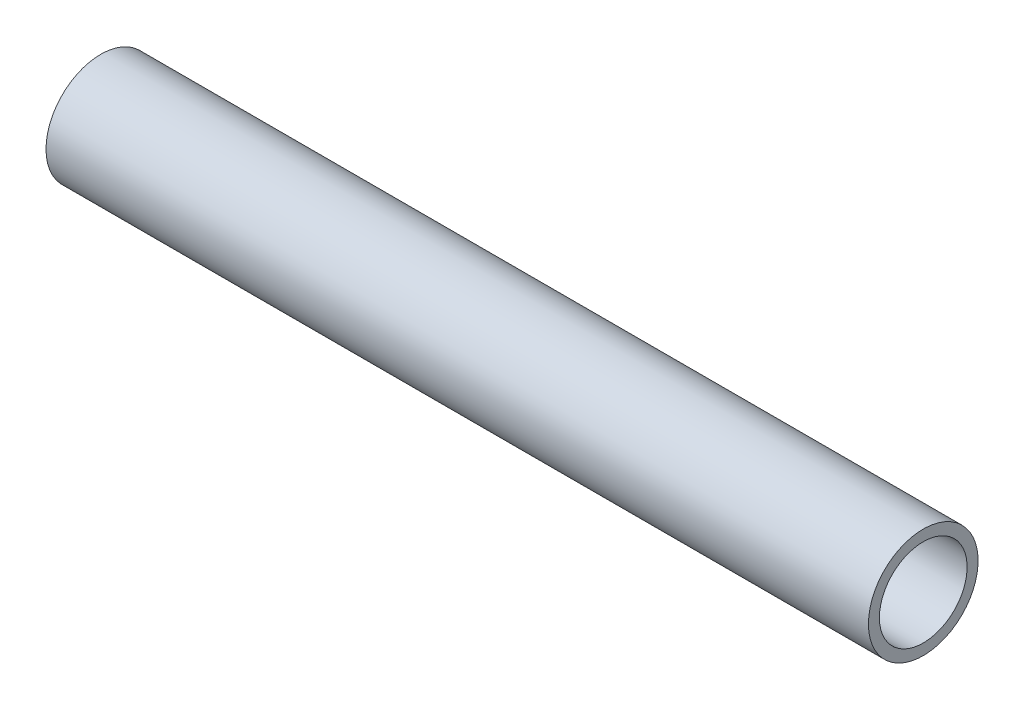
from build123d import *

# Parameters (mm, degrees)
SKETCH1_R           = 15.875
SKETCH1_R_2         = 12.7
EXTRUDE_THIN1_DEPTH = 119.046625


with BuildPart() as part:
    # Sketch1 → Extrude-Thin1 (new, symmetric)
    with BuildSketch(Plane(origin=(0, 0, 0), x_dir=(0, 0, -1), z_dir=(1, 0, 0))):
        Circle(SKETCH1_R)
        Circle(SKETCH1_R_2, mode=Mode.SUBTRACT)
    extrude(amount=EXTRUDE_THIN1_DEPTH, both=True)


solid = part.part
